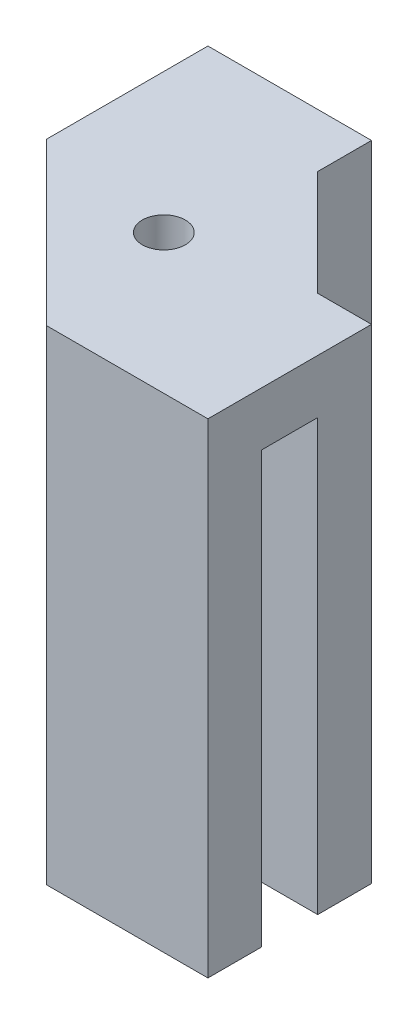
from build123d import *

# Parameters (mm, degrees)
BOSS_EXTRUDE1_DEPTH         = 50.8
TAP_DRILL_FOR_1_4_20_TAP1_D = 5.08
SKETCH4_R                   = 2.5399999999999947
BOSS_EXTRUDE2_DEPTH         = 6.35


with BuildPart() as part:
    # Sketch1 → Boss-Extrude1 (new body)
    with BuildSketch(Plane(origin=(0, 0, 0), x_dir=(1, 0, 0), z_dir=(0, 1, 0))):
        Polygon((22.098000000000056, 9.651999999999928), (9.652, 22.09800000000003), (9.652000000000001, 28.447999999999904), (3.3019999999999996, 28.447999999999904), (3.302000000000003, 15.747999999999971), (-3.3020000000000005, 15.747999999999967), (-3.3020000000000014, 28.447999999999904), (-9.652000000000001, 28.447999999999904), (-9.652, 9.397999999999909), (9.397999999999879, -9.652000000000031), (28.447999999999862, -9.652000000000092), (28.44799999999989, -3.3020000000001004), (15.747999999999957, -3.3020000000000556), (15.747999999999982, 3.3019999999999445), (28.447999999999915, 3.3019999999998992), (28.447999999999933, 9.65199999999991), align=None)
    extrude(amount=BOSS_EXTRUDE1_DEPTH)

    # Tap Drill for 1/4-20 Tap1 (through all)
    with Locations(Plane(origin=(0, 50.8, 0), x_dir=(1, 0, 0), z_dir=(0, 1, 0))):
        with Locations((6.795346667, 6.795346667)):
            Hole(TAP_DRILL_FOR_1_4_20_TAP1_D / 2)

    # Sketch4 → Boss-Extrude2 (add)
    with BuildSketch(Plane(origin=(0, 50.8, 0), x_dir=(1, 0, 0), z_dir=(0, 1, 0))):
        Polygon((-3.3020000000000014, 28.447999999999904), (3.3019999999999996, 28.447999999999904), (9.652000000000001, 28.447999999999904), (9.652, 22.09800000000003), (22.098000000000056, 9.651999999999928), (28.447999999999933, 9.65199999999991), (28.447999999999915, 3.3019999999998992), (28.44799999999989, -3.3020000000001004), (28.447999999999862, -9.652000000000092), (9.397999999999879, -9.652000000000031), (-9.652, 9.397999999999909), (-9.652000000000001, 28.447999999999904), align=None)
        with Locations((6.7953466666666715, 6.7953466666666476)):
            Circle(SKETCH4_R, mode=Mode.SUBTRACT)
    extrude(amount=BOSS_EXTRUDE2_DEPTH)


solid = part.part
